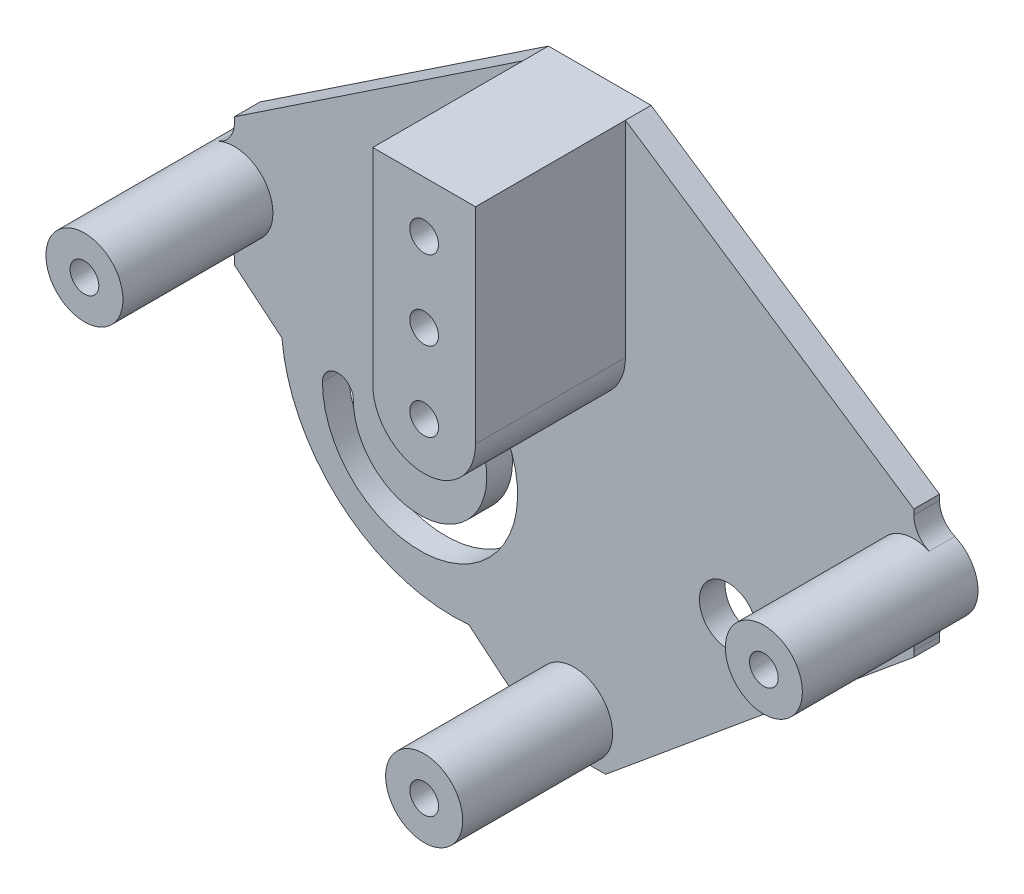
from build123d import *
from build123d.topology import SkipClean

# Parameters (mm, degrees)
SKETCH1_W               = 84.00796
SKETCH1_H               = 71.2724
BOSS_EXTRUDE1_DEPTH     = 3.175
SKETCH5_R               = 4.7625
BOSS_EXTRUDE3_DEPTH     = 3.175
SKETCH3_R               = 1.8415
CUT_EXTRUDE1_DEPTH      = 114.886040389
BOSS_EXTRUDE4_START     = 18.542
SKETCH6_R               = 4.7625
BOSS_EXTRUDE4_DEPTH     = 18.542
CUT_EXTRUDE2_DEPTH      = 116.341906237
CUT_EXTRUDE2_DEPTH_BACK = 116.341906237
SKETCH4_R               = 1.778
SKETCH7_R               = 1.778
CUT_EXTRUDE3_DEPTH      = 116.894683482
SKETCH8_R               = 3.556
SKETCH8_R_2             = 3.4925
CUT_EXTRUDE4_DEPTH      = 116.894683482
CUT_EXTRUDE5_DEPTH      = 116.894683482
FILLET1_R               = 3.175
BOSS_EXTRUDE5_DEPTH     = 3.175
CUT_EXTRUDE7_DEPTH      = 5.08


with BuildPart() as part:
    # Sketch1 → Boss-Extrude1 (new body)
    with BuildSketch(Plane.XY):
        with Locations((42.00398, 35.6362)):
            Rectangle(SKETCH1_W, SKETCH1_H)
    extrude(amount=BOSS_EXTRUDE1_DEPTH)

    # Sketch5 → Boss-Extrude3 (add)
    with BuildSketch(Plane.XY.offset(3.175)):
        with Locations((84.00796, 39.524999944)):
            Circle(SKETCH5_R)
        with Locations((0, 39.524999944)):
            Circle(SKETCH5_R)
    extrude(amount=-BOSS_EXTRUDE3_DEPTH)

    # Sketch3 → Cut-Extrude1 (cut, through all)
    with BuildSketch(Plane.XY.offset(3.175)):
        with Locations((42.00398, 4.7625)):
            Circle(SKETCH3_R)
    extrude(amount=-CUT_EXTRUDE1_DEPTH, mode=Mode.SUBTRACT)

    # Sketch6 → Boss-Extrude4 (add)
    with BuildSketch(Plane.XY.offset(3.175).offset(BOSS_EXTRUDE4_START)):
        with Locations((84.00796, 39.524999944)):
            Circle(SKETCH6_R)
        with Locations((0, 39.524999944)):
            Circle(SKETCH6_R)
        with Locations(Location((42.00398, 4.7625, 0), (0, 0, 270))):
            Circle(SKETCH6_R)
        with BuildLine():
            Line((35.65398, 71.2724), (48.35398, 71.2724))
            Line((48.35398, 71.2724), (48.35398, 45.8724))
            ThreePointArc((48.35398, 45.8724), (42.00398, 39.5224), (35.65398, 45.8724))
            Line((35.65398, 45.8724), (35.65398, 71.2724))
        make_face()
    extrude(amount=-BOSS_EXTRUDE4_DEPTH)

    # Sketch4 → Cut-Extrude2 (cut, two sides: drawn at the far end of the back side and taken through both)
    with BuildSketch(Plane.XY.offset(3.175).offset(-CUT_EXTRUDE2_DEPTH_BACK)):
        with Locations((42.00398, 64.9224)):
            Circle(SKETCH4_R)
        with Locations((42.00398, 55.1434)):
            Circle(SKETCH4_R)
        with Locations((42.00398, 45.3644)):
            Circle(SKETCH4_R)
    extrude(amount=CUT_EXTRUDE2_DEPTH + CUT_EXTRUDE2_DEPTH_BACK, mode=Mode.SUBTRACT)

    # Sketch7 → Cut-Extrude3 (cut, through all)
    with BuildSketch(Plane(origin=(0, 0, 0), x_dir=(-1, 0, 0), z_dir=(0, 0, -1))):
        with Locations((-42.00398, 4.7625)):
            Circle(SKETCH7_R)
        with Locations((0, 39.524999944)):
            Circle(SKETCH7_R)
        with Locations((-84.00796, 39.524999944)):
            Circle(SKETCH7_R)
    extrude(amount=-CUT_EXTRUDE3_DEPTH, mode=Mode.SUBTRACT)

    # Sketch8 → Cut-Extrude4 (cut, through all)
    with BuildSketch(Plane(origin=(0, 0, 0), x_dir=(-1, 0, 0), z_dir=(0, 0, -1))):
        with Locations((-61.05398, 24.524999972)):
            Circle(SKETCH8_R)
        with Locations((-22.95398, 24.524999972)):
            Circle(SKETCH8_R_2)
    extrude(amount=-CUT_EXTRUDE4_DEPTH, mode=Mode.SUBTRACT)

    # Sketch9 → Cut-Extrude5 (cut, through all)
    with BuildSketch(Plane(origin=(0, 0, 0), x_dir=(-1, 0, 0), z_dir=(0, 0, -1))):
        Polygon((-84.00796, 0), (-84.00796, 31.587499944), (-45.90796, 0), align=None)
        Polygon((-84.00796, 71.2724), (-84.00796, 47.462499944), (-48.35398, 71.2724), align=None)
    cut_extrude5 = extrude(amount=-CUT_EXTRUDE5_DEPTH, mode=Mode.SUBTRACT)

    # Mirror1: Cut-Extrude5 across plane
    add(cut_extrude5.mirror(Plane(origin=(42.00398, 0, 0), x_dir=(0, 0, 1), z_dir=(1, 0, 0))), mode=Mode.SUBTRACT)

    # Fillet1
    # the kernel refuses this fillet: 3.175 mm, written as the material it adds along each edge
    with BuildSketch(Plane(origin=(84.00796, 34.762499944, 0), x_dir=(0.9789063129307042, 0.2043096436892158, 0), z_dir=(0, 0, 1))) as fillet1_piece_1:
        with BuildLine():
            CenterArc((2.594732475, -3.108027544), FILLET1_R, 101.789089239, 66.421821522)
            Line((-0.513295069, -2.459344425), (0, 0))
            ThreePointArc((0, 0), (0.973024678, -0.100458685), (1.946049356, 0))
        make_face()
    extrude(amount=3.175)
    with BuildSketch(Plane(origin=(84.00796, 44.287499944, 0), x_dir=(0, 1, 0), z_dir=(0, 0, 1)), Plane(origin=(0, 34.762499944, 0), x_dir=(0, -1, 0), z_dir=(0, 0, 1))) as fillet1_piece_2:
        with BuildLine():
            CenterArc((2.512338916, -3.175), FILLET1_R, 90, 66.421821522)
            ThreePointArc((-0.397596651, -1.905), (-0.100458685, -0.973024678), (0, 0))
            Line((0, 0), (2.512338916, 0))
        make_face()
    extrude(amount=3.175)
    with BuildSketch(Plane(origin=(0, 44.287499944, 0), x_dir=(0, 1, 0), z_dir=(0, 0, 1))) as fillet1_piece_3:
        with BuildLine():
            CenterArc((2.512338916, 3.175), FILLET1_R, 203.578178478, 66.421821522)
            ThreePointArc((-0.397596651, 1.905), (-0.100458685, 0.973024678), (0, 0))
            Line((0, 0), (2.512338916, 0))
        make_face()
    extrude(amount=3.175)

    # Sketch10 → Boss-Extrude5 (add)
    with BuildSketch(Plane(origin=(0, 0, 0), x_dir=(-1, 0, 0), z_dir=(0, 0, -1))):
        with BuildLine():
            Line((-23.070402794, 12.460561704), (-28.975644685, 7.564713202))
            ThreePointArc((-28.975644685, 7.564713202), (-13.458086548, 12.356642178), (-5.873921435, 26.717618238))
            Line((-5.873921435, 26.717618238), (-11.078476776, 22.402686701))
            ThreePointArc((-11.078476776, 22.402686701), (-11.084404387, 22.364145909), (-11.091119617, 22.325734519))
            ThreePointArc((-11.091119617, 22.325734519), (-15.284227222, 15.211616198), (-23.070402794, 12.460561704))
        make_face()
    extrude(amount=-BOSS_EXTRUDE5_DEPTH)

    # Sketch11 → Cut-Extrude7 (cut)
    with SkipClean():  # the faces are left unmerged after this step: merging them gives an invalid solid
        with BuildSketch(Plane(origin=(0, 0, 0), x_dir=(-1, 0, 0), z_dir=(0, 0, -1))):
            with BuildLine():
                ThreePointArc((-25.8996445, 32.236555305), (-24.799823539, 34.695913728), (-27.259181962, 35.795734689))
                ThreePointArc((-27.259181962, 35.795734689), (-34.829175406, 22.39334356), (-23.070402794, 12.460561704))
                Line((-23.070402794, 12.460561704), (-11.078476776, 22.402686701))
                ThreePointArc((-11.078476776, 22.402686701), (-11.084404387, 22.364145909), (-11.091119617, 22.325734519))
                ThreePointArc((-11.091119617, 22.325734519), (-10.939621184, 23.420732233), (-10.88898, 24.524999972))
                ThreePointArc((-10.88898, 24.524999972), (-12.79398, 26.429999972), (-14.69898, 24.524999972))
                ThreePointArc((-14.69898, 24.524999972), (-27.635249302, 17.725680688), (-25.8996445, 32.236555305))
            make_face()
            with BuildLine():
                ThreePointArc((-21.368554277, 36.485378322), (-24.356904724, 36.508155951), (-27.259181962, 35.795734689))
                ThreePointArc((-27.259181962, 35.795734689), (-24.799823539, 34.695913728), (-25.8996445, 32.236555305))
                ThreePointArc((-25.8996445, 32.236555305), (-23.913875864, 32.724001431), (-21.869215031, 32.708416738))
                ThreePointArc((-21.869215031, 32.708416738), (-19.730403862, 34.346567153), (-21.368554277, 36.485378322))
            make_face()
        extrude(amount=-CUT_EXTRUDE7_DEPTH, mode=Mode.SUBTRACT)


solid = part.part
